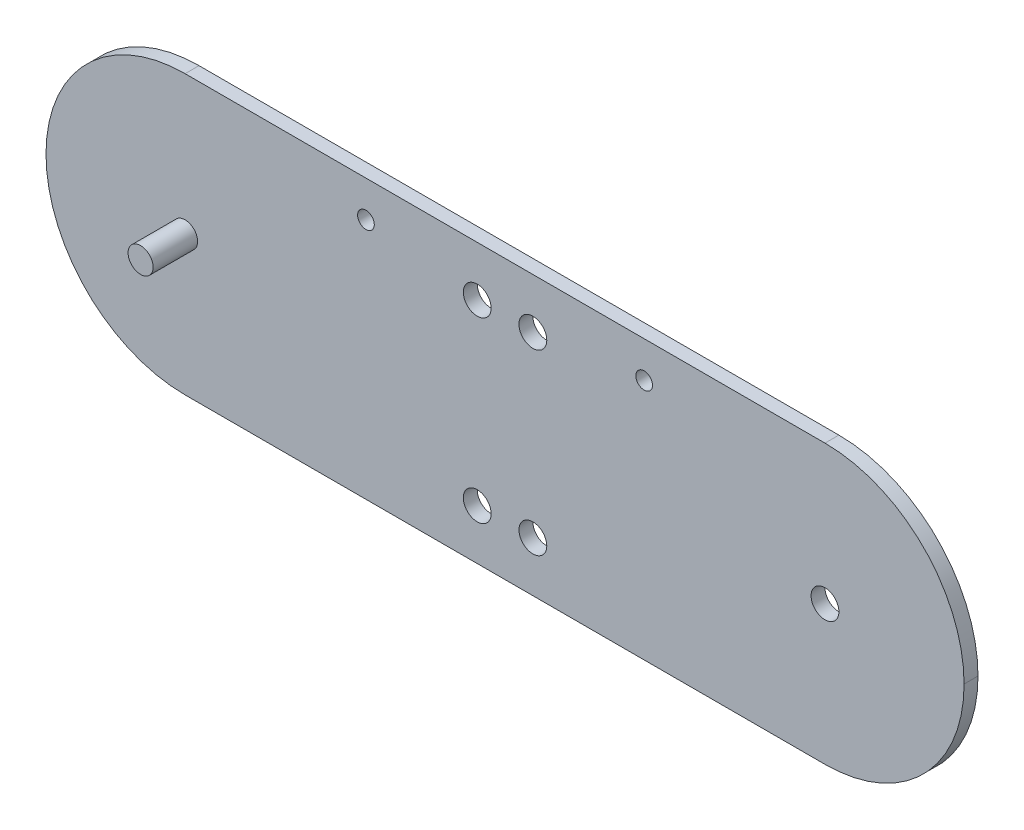
from build123d import *

# Parameters (mm, degrees)
SKETCH1_W           = 165
SKETCH1_H           = 50
BOSS_EXTRUDE1_DEPTH = 2.5
FILLET1_R           = 25
SKETCH2_R           = 2.5
CUT_EXTRUDE1_DEPTH  = 2.5
SKETCH3_R           = 2.5
CUT_EXTRUDE2_DEPTH  = 2.5
SKETCH4_R           = 2.25
BOSS_EXTRUDE2_DEPTH = 8
SKETCH6_R           = 1.5
CUT_EXTRUDE4_DEPTH  = 87.841810207


with BuildPart() as part:
    # Sketch1 → Boss-Extrude1 (new body)
    with BuildSketch(Plane.XY):
        Rectangle(SKETCH1_W, SKETCH1_H)
    extrude(amount=BOSS_EXTRUDE1_DEPTH)

    # Fillet1
    fillet1_edges = [part.edges().sort_by_distance(p)[0] for p in [
        (-82.5, -25, 1.25),
        (-82.5, 25, 1.25),
        (82.5, -25, 1.25),
        (82.5, 25, 1.25),
    ]]
    fillet(fillet1_edges, radius=FILLET1_R - 0.0001)  # a hair under: the kernel refuses the full size

    # Sketch2 → Cut-Extrude1 (cut)
    with BuildSketch(Plane.XY.offset(2.5)):
        with Locations((-5, 16)):
            Circle(SKETCH2_R)
        with Locations((5, 16)):
            Circle(SKETCH2_R)
    cut_extrude1 = extrude(amount=-CUT_EXTRUDE1_DEPTH, mode=Mode.SUBTRACT)

    # Mirror1: Cut-Extrude1 across plane
    add(cut_extrude1.mirror(Plane.ZX), mode=Mode.SUBTRACT)

    # Sketch3 → Cut-Extrude2 (cut)
    with BuildSketch(Plane(origin=(0, 0, 0), x_dir=(-1, 0, 0), z_dir=(0, 0, -1))):
        with Locations((-57.5, 0)):
            Circle(SKETCH3_R)
    extrude(amount=-CUT_EXTRUDE2_DEPTH, mode=Mode.SUBTRACT)

    # Sketch4 → Boss-Extrude2 (add)
    with BuildSketch(Plane.XY.offset(2.5)):
        with Locations(Location((-57.5, 0, 0), (0, 0, 180))):
            Circle(SKETCH4_R)
    extrude(amount=BOSS_EXTRUDE2_DEPTH)

    # Sketch6 → Cut-Extrude4 (cut, through all)
    with BuildSketch(Plane(origin=(0, 0, 0), x_dir=(-1, 0, 0), z_dir=(0, 0, -1))):
        with Locations((-25, 18.5)):
            Circle(SKETCH6_R)
        with Locations((25, 18.5)):
            Circle(SKETCH6_R)
    extrude(amount=-CUT_EXTRUDE4_DEPTH, mode=Mode.SUBTRACT)


solid = part.part
